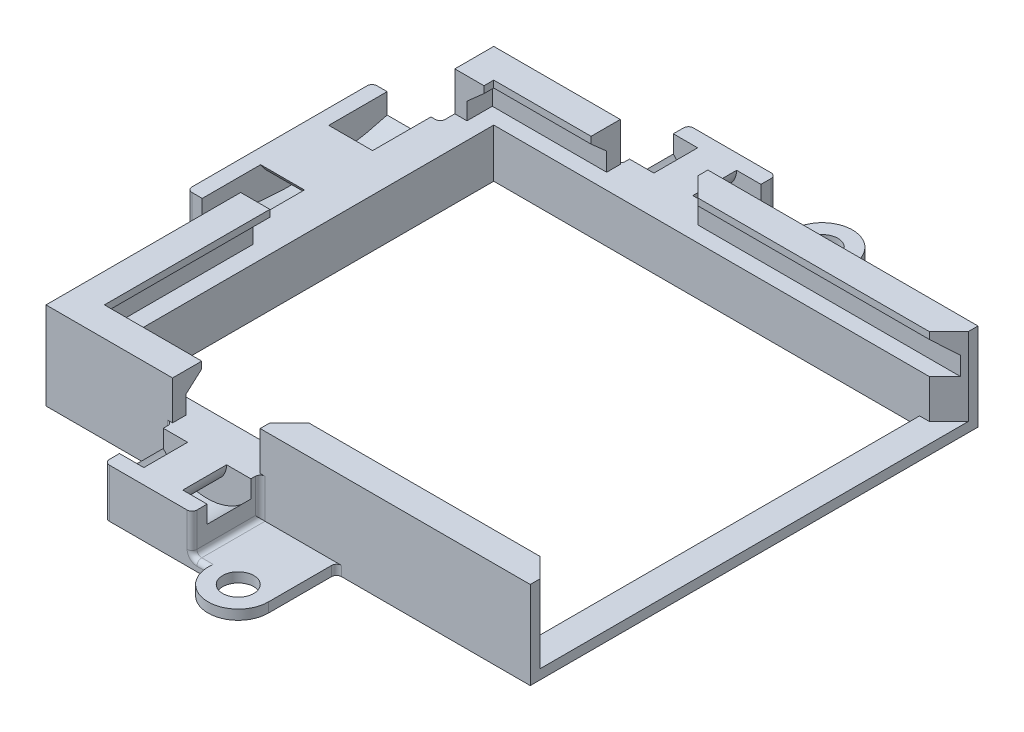
from build123d import *

# Parameters (mm, degrees)
CROQUIS1_R              = 1.6
CROQUIS1_W              = 43.75
CROQUIS1_H              = 40
SALIENTE_EXTRUIR1_DEPTH = 1
SALIENTE_EXTRUIR2_DEPTH = 8
CROQUIS3_W              = 43.2
CROQUIS3_H              = 1.8
CORTAR_EXTRUIR1_DEPTH   = 48.5
CROQUIS4_W              = 9
CROQUIS4_H              = 3
CORTAR_EXTRUIR3_DEPTH   = 4
CHAFL_N2_SIZE           = 2
CROQUIS5_W              = 9
CROQUIS5_H              = 7
SALIENTE_EXTRUIR3_DEPTH = 4
CORTAR_EXTRUIR7_DEPTH   = 2.25
CROQUIS9_W              = 10
CROQUIS9_H              = 19
SALIENTE_EXTRUIR4_DEPTH = 5
CROQUIS10_W             = 3
CROQUIS10_H             = 22
CORTAR_EXTRUIR5_DEPTH   = 4
REDONDEO2_R             = 0.5
CORTAR_EXTRUIR8_DEPTH   = 2.25


with BuildPart() as part:
    # Croquis1 → Saliente-Extruir1 (new body)
    with BuildSketch(Plane(origin=(0, 0, 0), x_dir=(1, 0, 0), z_dir=(0, 1, 0))):
        with BuildLine():
            Line((4.975, -30), (4.975, -23))
            Line((4.975, -23), (24.875, -23))
            Line((24.875, -23), (24.875, 23))
            Line((24.875, 23), (4.975, 23))
            Line((4.975, 23), (4.975, 30))
            ThreePointArc((4.975, 30), (1.875, 33.1), (-1.225, 30))
            Line((-1.225, 30), (-11.875, 30))
            Line((-11.875, 30), (-11.875, 23))
            Line((-11.875, 23), (-24.875, 23))
            Line((-24.875, 23), (-24.875, -23))
            Line((-24.875, -23), (-11.875, -23))
            Line((-11.875, -23), (-11.875, -30))
            Line((-11.875, -30), (-1.225, -30))
            ThreePointArc((-1.225, -30), (1.875, -33.1), (4.975, -30))
        make_face()
        with Locations(Location((1.875, -30, 0), (0, 0, 270))):
            Circle(CROQUIS1_R, mode=Mode.SUBTRACT)
        with Locations(Location((1.875, 30, 0), (0, 0, 90))):
            Circle(CROQUIS1_R, mode=Mode.SUBTRACT)
        Rectangle(CROQUIS1_W, CROQUIS1_H, mode=Mode.SUBTRACT)
    extrude(amount=SALIENTE_EXTRUIR1_DEPTH)

    # Croquis2 → Saliente-Extruir2 (add)
    with BuildSketch(Plane(origin=(0, 1, 0), x_dir=(1, 0, 0), z_dir=(0, 1, 0))):
        Polygon((21.875, -20), (24.875, -20), (24.875, -23), (-24.875, -23), (-24.875, 23), (24.875, 23), (24.875, 20), (21.875, 20), (-21.875, 20), (-21.875, -20), align=None)
    extrude(amount=SALIENTE_EXTRUIR2_DEPTH)

    # Croquis3 → Cortar-Extruir1 (cut)
    with BuildSketch(Plane.ZY.offset(-24.875)):
        with Locations((0, 5.9)):
            Rectangle(CROQUIS3_W, CROQUIS3_H)
    extrude(amount=CORTAR_EXTRUIR1_DEPTH, mode=Mode.SUBTRACT)

    # Chaflán1
    # the kernel refuses this chamfer: 1.7, 1.5 mm, written as the material it takes off along each edge
    with BuildSketch(Plane(origin=(24.875, 6.8, -20), x_dir=(0, 0.9994558527200353, 0.03298482171646588), z_dir=(-1, 0, 0))) as chafl_n1_piece_1_section:
        with BuildLine():
            Line((1.545831431, 0), (-0.102721849, 1.748552182))
            Line((-0.102721849, 1.748552182), (-0.136703348, 1.747430698))
            ThreePointArc((-0.136703348, 1.747430698), (-0.062859529, 0.873896605), (-0.033981499, -0.001121484))
            Line((-0.033981499, -0.001121484), (0.001121484, -0.033981499))
            ThreePointArc((0.001121484, -0.033981499), (0.773196268, -0.008500885), (1.546952915, -0.033981499))
            Line((1.546952915, -0.033981499), (1.545831431, 0))
        make_face()
    chafl_n1_piece_1 = extrude(amount=46.75, mode=Mode.PRIVATE)
    chafl_n1_piece_1 = split(chafl_n1_piece_1, bisect_by=Plane(origin=(1.5, 7.297528396, -21.6), z_dir=(0, 0, 1)), keep=Keep.TOP, mode=Mode.PRIVATE)
    add(chafl_n1_piece_1, mode=Mode.SUBTRACT)
    with BuildSketch(Plane(origin=(-21.875, 6.8, 20), x_dir=(0, 0.9994558527200353, -0.03298482171646588), z_dir=(1, 0, 0))) as chafl_n1_piece_2_section:
        with BuildLine():
            Line((1.545831431, 0), (-0.102721849, 1.748552182))
            Line((-0.102721849, 1.748552182), (-0.136703348, 1.747430698))
            ThreePointArc((-0.136703348, 1.747430698), (-0.062859529, 0.873896605), (-0.033981499, -0.001121484))
            Line((-0.033981499, -0.001121484), (0.001121484, -0.033981499))
            ThreePointArc((0.001121484, -0.033981499), (0.773196268, -0.008500885), (1.546952915, -0.033981499))
            Line((1.546952915, -0.033981499), (1.545831431, 0))
        make_face()
    chafl_n1_piece_2 = extrude(amount=46.75, mode=Mode.PRIVATE)
    chafl_n1_piece_2 = split(chafl_n1_piece_2, bisect_by=Plane(origin=(1.5, 7.297528396, 21.6), z_dir=(0, 0, -1)), keep=Keep.TOP, mode=Mode.PRIVATE)
    add(chafl_n1_piece_2, mode=Mode.SUBTRACT)
    with BuildSketch(Plane(origin=(-21.875, 6.8, -20), x_dir=(0.03298482171646358, 0.9994558527200355, 0), z_dir=(0, 0, 1))) as chafl_n1_piece_3:
        with BuildLine():
            Line((1.545831431, 0), (-0.102721849, 1.748552182))
            Line((-0.102721849, 1.748552182), (-0.136703348, 1.747430698))
            ThreePointArc((-0.136703348, 1.747430698), (-0.062859529, 0.873896605), (-0.033981499, -0.001121484))
            Line((-0.033981499, -0.001121484), (0.001121484, -0.033981499))
            ThreePointArc((0.001121484, -0.033981499), (0.773196268, -0.008500885), (1.546952915, -0.033981499))
            Line((1.546952915, -0.033981499), (1.545831431, 0))
        make_face()
    extrude(amount=40, mode=Mode.SUBTRACT)
    with BuildSketch(Plane(origin=(24.875, 6.8, -20), x_dir=(0, 0.9994558527200353, 0.03298482171646588), z_dir=(-1, 0, 0))) as chafl_n1_piece_4a_section:
        with BuildLine():
            Line((1.545831431, 0), (-0.102721849, 1.748552182))
            Line((-0.102721849, 1.748552182), (-0.136703348, 1.747430698))
            ThreePointArc((-0.136703348, 1.747430698), (-0.062859529, 0.873896605), (-0.033981499, -0.001121484))
            Line((-0.033981499, -0.001121484), (0.001121484, -0.033981499))
            ThreePointArc((0.001121484, -0.033981499), (0.773196268, -0.008500885), (1.546952915, -0.033981499))
            Line((1.546952915, -0.033981499), (1.545831431, 0))
        make_face()
    chafl_n1_piece_4a = extrude(amount=51.128917184, mode=Mode.PRIVATE)
    chafl_n1_piece_4a = split(chafl_n1_piece_4a, bisect_by=Plane(origin=(-21.875, 7.297528396, -20.551236264), z_dir=(-1, 0, 0)), keep=Keep.TOP, mode=Mode.PRIVATE)
    chafl_n1_piece_4a = split(chafl_n1_piece_4a, bisect_by=Plane(origin=(-23.625, 7.297528396, -20.551236264), z_dir=(1, 0, 0)), keep=Keep.TOP, mode=Mode.PRIVATE)
    chafl_n1_piece_4a = split(chafl_n1_piece_4a, bisect_by=Plane(origin=(-22.75, 7.297528396, -21.6), z_dir=(0, 0, 1)), keep=Keep.TOP, mode=Mode.PRIVATE)
    with BuildSketch(Plane(origin=(-21.875, 6.8, -24.378917184), x_dir=(0.03298482171646588, 0.9994558527200353, 0), z_dir=(0, 0, 1))) as chafl_n1_piece_4b_section:
        with BuildLine():
            Line((1.545831431, 0), (-0.102721849, 1.748552182))
            Line((-0.102721849, 1.748552182), (-0.136703348, 1.747430698))
            ThreePointArc((-0.136703348, 1.747430698), (-0.062859529, 0.873896605), (-0.033981499, -0.001121484))
            Line((-0.033981499, -0.001121484), (0.001121484, -0.033981499))
            ThreePointArc((0.001121484, -0.033981499), (0.773196268, -0.008500885), (1.546952915, -0.033981499))
            Line((1.546952915, -0.033981499), (1.545831431, 0))
        make_face()
    chafl_n1_piece_4b = extrude(amount=44.378917184, mode=Mode.PRIVATE)
    chafl_n1_piece_4b = split(chafl_n1_piece_4b, bisect_by=Plane(origin=(-22.437497136, 7.292287741, -20), z_dir=(0, 0, -1)), keep=Keep.TOP, mode=Mode.PRIVATE)
    chafl_n1_piece_4b = split(chafl_n1_piece_4b, bisect_by=Plane(origin=(-22.437497136, 7.292287741, -21.6), z_dir=(0, 0, 1)), keep=Keep.TOP, mode=Mode.PRIVATE)
    chafl_n1_piece_4 = chafl_n1_piece_4a & chafl_n1_piece_4b
    add(chafl_n1_piece_4, mode=Mode.SUBTRACT)
    with BuildSketch(Plane(origin=(-21.875, 6.8, -20), x_dir=(0.03298482171646358, 0.9994558527200355, 0), z_dir=(0, 0, 1))) as chafl_n1_piece_5a_section:
        with BuildLine():
            Line((1.545831431, 0), (-0.102721849, 1.748552182))
            Line((-0.102721849, 1.748552182), (-0.136703348, 1.747430698))
            ThreePointArc((-0.136703348, 1.747430698), (-0.062859529, 0.873896605), (-0.033981499, -0.001121484))
            Line((-0.033981499, -0.001121484), (0.001121484, -0.033981499))
            ThreePointArc((0.001121484, -0.033981499), (0.773196268, -0.008500885), (1.546952915, -0.033981499))
            Line((1.546952915, -0.033981499), (1.545831431, 0))
        make_face()
    chafl_n1_piece_5a = extrude(amount=44.378917184, mode=Mode.PRIVATE)
    chafl_n1_piece_5a = split(chafl_n1_piece_5a, bisect_by=Plane(origin=(-22.437497136, 7.292287741, 20), z_dir=(0, 0, 1)), keep=Keep.TOP, mode=Mode.PRIVATE)
    chafl_n1_piece_5a = split(chafl_n1_piece_5a, bisect_by=Plane(origin=(-22.437497136, 7.292287741, 21.6), z_dir=(0, 0, -1)), keep=Keep.TOP, mode=Mode.PRIVATE)
    with BuildSketch(Plane(origin=(-26.253917184, 6.8, 20), x_dir=(0, 0.9994558527200353, -0.03298482171646588), z_dir=(1, 0, 0))) as chafl_n1_piece_5b_section:
        with BuildLine():
            Line((1.545831431, 0), (-0.102721849, 1.748552182))
            Line((-0.102721849, 1.748552182), (-0.136703348, 1.747430698))
            ThreePointArc((-0.136703348, 1.747430698), (-0.062859529, 0.873896605), (-0.033981499, -0.001121484))
            Line((-0.033981499, -0.001121484), (0.001121484, -0.033981499))
            ThreePointArc((0.001121484, -0.033981499), (0.773196268, -0.008500885), (1.546952915, -0.033981499))
            Line((1.546952915, -0.033981499), (1.545831431, 0))
        make_face()
    chafl_n1_piece_5b = extrude(amount=51.128917184, mode=Mode.PRIVATE)
    chafl_n1_piece_5b = split(chafl_n1_piece_5b, bisect_by=Plane(origin=(-21.875, 7.297528396, 20.551236264), z_dir=(-1, 0, 0)), keep=Keep.TOP, mode=Mode.PRIVATE)
    chafl_n1_piece_5b = split(chafl_n1_piece_5b, bisect_by=Plane(origin=(-22.75, 7.297528396, 21.6), z_dir=(0, 0, -1)), keep=Keep.TOP, mode=Mode.PRIVATE)
    chafl_n1_piece_5b = split(chafl_n1_piece_5b, bisect_by=Plane(origin=(-23.625, 7.297528396, 20.551236264), z_dir=(1, 0, 0)), keep=Keep.TOP, mode=Mode.PRIVATE)
    chafl_n1_piece_5 = chafl_n1_piece_5a & chafl_n1_piece_5b
    add(chafl_n1_piece_5, mode=Mode.SUBTRACT)

    # Croquis4 → Cortar-Extruir3 (cut)
    with BuildSketch(Plane(origin=(0, 9, 0), x_dir=(1, 0, 0), z_dir=(0, 1, 0))):
        with Locations((-7.375, -21.5)):
            Rectangle(CROQUIS4_W, CROQUIS4_H)
        with Locations((-7.375, 21.5)):
            Rectangle(CROQUIS4_W, CROQUIS4_H)
    extrude(amount=-CORTAR_EXTRUIR3_DEPTH, mode=Mode.SUBTRACT)

    # Chaflán2
    # the kernel refuses this chamfer: 2 mm, written as the material it takes off along each edge
    with BuildSketch(Plane(origin=(-2.875, 14.143365976, 20), x_dir=(-0.027495876610586296, 0, 0.9996219169112968), z_dir=(0, -1, 0))) as chafl_n2_piece_1_section:
        Polygon((CHAFL_N2_SIZE * 0.999621916911, -CHAFL_N2_SIZE * 0.0274958766106), (-CHAFL_N2_SIZE * 0.0274958766106, -CHAFL_N2_SIZE * 0.999621916911), (0, 0), align=None)
    chafl_n2_piece_1 = extrude(amount=10.986731952, mode=Mode.PRIVATE)
    chafl_n2_piece_1 = split(chafl_n2_piece_1, bisect_by=Plane(origin=(-2.743425682, 5, 21.736851363), z_dir=(0, 1, 0)), keep=Keep.TOP, mode=Mode.PRIVATE)
    add(chafl_n2_piece_1, mode=Mode.SUBTRACT)
    with BuildSketch(Plane(origin=(-2.875, 14.143365976, -20), x_dir=(0.9996219169112968, 0, 0.027495876610585623), z_dir=(0, -1, 0))) as chafl_n2_piece_2_section:
        Polygon((CHAFL_N2_SIZE * 0.999621916911, -CHAFL_N2_SIZE * 0.0274958766106), (-CHAFL_N2_SIZE * 0.0274958766106, -CHAFL_N2_SIZE * 0.999621916911), (0, 0), align=None)
    chafl_n2_piece_2 = extrude(amount=10.986731952, mode=Mode.PRIVATE)
    chafl_n2_piece_2 = split(chafl_n2_piece_2, bisect_by=Plane(origin=(-2.25030089, 5, -20.750601779), z_dir=(0, 1, 0)), keep=Keep.TOP, mode=Mode.PRIVATE)
    add(chafl_n2_piece_2, mode=Mode.SUBTRACT)
    with BuildSketch(Plane(origin=(24.875, 3.156634024, 20), x_dir=(-0.9996219169112968, 0, -0.027495876610585647), z_dir=(0, 1, 0))) as chafl_n2_piece_3:
        Polygon((CHAFL_N2_SIZE * 0.999621916911, CHAFL_N2_SIZE * 0.0274958766106), (-CHAFL_N2_SIZE * 0.0274958766106, CHAFL_N2_SIZE * 0.999621916911), (0, 0), align=None)
    extrude(amount=10.986731952, mode=Mode.SUBTRACT)
    with BuildSketch(Plane(origin=(24.875, 3.156634024, -20), x_dir=(-0.9996219169112968, 0, 0.027495876610585647), z_dir=(0, 1, 0))) as chafl_n2_piece_4:
        Polygon((CHAFL_N2_SIZE * 0.999621916911, -CHAFL_N2_SIZE * 0.0274958766106), (-CHAFL_N2_SIZE * 0.0274958766106, -CHAFL_N2_SIZE * 0.999621916911), (0, 0), align=None)
    extrude(amount=10.986731952, mode=Mode.SUBTRACT)
    with BuildSketch(Plane(origin=(24.875, 1, 20), x_dir=(-0.9996219169112968, 0, -0.027495876610587326), z_dir=(0, 1, 0))) as chafl_n2_piece_5:
        Polygon((CHAFL_N2_SIZE * 0.999621916911, CHAFL_N2_SIZE * 0.0274958766106), (-CHAFL_N2_SIZE * 0.0274958766106, CHAFL_N2_SIZE * 0.999621916911), (0, 0), align=None)
    extrude(amount=9.143365976, mode=Mode.SUBTRACT)
    with BuildSketch(Plane(origin=(24.875, 1, -20), x_dir=(-0.9996219169112968, 0, 0.027495876610585647), z_dir=(0, 1, 0))) as chafl_n2_piece_6:
        Polygon((CHAFL_N2_SIZE * 0.999621916911, -CHAFL_N2_SIZE * 0.0274958766106), (-CHAFL_N2_SIZE * 0.0274958766106, -CHAFL_N2_SIZE * 0.999621916911), (0, 0), align=None)
    extrude(amount=9.143365976, mode=Mode.SUBTRACT)

    # Croquis5 → Saliente-Extruir3 (add)
    with BuildSketch(Plane(origin=(0, 1, 0), x_dir=(1, 0, 0), z_dir=(0, 1, 0))):
        with Locations((-7.375, 26.5)):
            Rectangle(CROQUIS5_W, CROQUIS5_H)
        with Locations((-7.375, -26.5)):
            Rectangle(CROQUIS5_W, CROQUIS5_H)
    extrude(amount=SALIENTE_EXTRUIR3_DEPTH)

    # Croquis8 → Cortar-Extruir7 (cut, symmetric)
    with BuildSketch(Plane(origin=(0, 0, -26.2), x_dir=(-1, 0, 0), z_dir=(0, 0, -1))):
        with BuildLine():
            Line((2.875, 5), (2.875, 3.2))
            ThreePointArc((2.875, 3.2), (7.375, 1), (11.875, 3.2))
            Line((11.875, 3.2), (11.875, 5))
            Line((11.875, 5), (9.375, 5))
            ThreePointArc((9.375, 5), (7.375, 3), (5.375, 5))
            Line((5.375, 5), (2.875, 5))
        make_face()
    cortar_extruir7 = extrude(amount=CORTAR_EXTRUIR7_DEPTH, both=True, mode=Mode.SUBTRACT)

    # Simetría1: Cortar-Extruir7 across plane
    add(cortar_extruir7.mirror(Plane.XY), mode=Mode.SUBTRACT)

    # Croquis9 → Saliente-Extruir4 (add)
    with BuildSketch(Plane(origin=(0, 0, 0), x_dir=(1, 0, 0), z_dir=(0, 1, 0))):
        with Locations((-26.875, 8)):
            Rectangle(CROQUIS9_W, CROQUIS9_H)
    extrude(amount=SALIENTE_EXTRUIR4_DEPTH)

    # Croquis10 → Cortar-Extruir5 (cut)
    with BuildSketch(Plane(origin=(0, 9, 0), x_dir=(1, 0, 0), z_dir=(0, 1, 0))):
        with Locations((-23.375, 8)):
            Rectangle(CROQUIS10_W, CROQUIS10_H)
    extrude(amount=-CORTAR_EXTRUIR5_DEPTH, mode=Mode.SUBTRACT)

    # Redondeo2
    redondeo2_edges = [part.edges().sort_by_distance(p)[0] for p in [
        (-2.05, 1, -30),
        (4.975, 0.5, 23),
        (-11.875, 2.5, 30),
        (-11.875, 2.5, 23),
        (-11.875, 2.5, -23),
        (-11.875, 2.5, -30),
        (4.975, 0.5, -23),
        (-2.875, 1, -26.5),
        (-2.875, 3, -23),
        (-2.875, 3, -30),
        (-2.05, 1, 30),
        (-2.875, 1, 26.5),
        (-2.875, 3, 30),
        (-2.875, 3, 23),
        (-24.875, 2.5, 1.5),
        (-24.875, 2.5, -17.5),
        (-31.875, 2.5, 1.5),
        (-31.875, 2.5, -17.5),
        (1.05, 1, -23),
    ]]
    fillet(redondeo2_edges, radius=REDONDEO2_R)

    # Croquis11 → Cortar-Extruir8 (cut, symmetric)
    with BuildSketch(Plane.ZY.offset(28.075)):
        with BuildLine():
            Line((-17.5, 5), (-17.5, 2.913949475))
            ThreePointArc((-17.5, 2.913949475), (-8, 1.6), (1.5, 2.913949475))
            Line((1.5, 2.913949475), (1.5, 5))
            Line((1.5, 5), (-4.5, 5))
            ThreePointArc((-4.5, 5), (-8, 3), (-11.5, 5))
            Line((-11.5, 5), (-17.5, 5))
        make_face()
    extrude(amount=CORTAR_EXTRUIR8_DEPTH, both=True, mode=Mode.SUBTRACT)


solid = part.part
